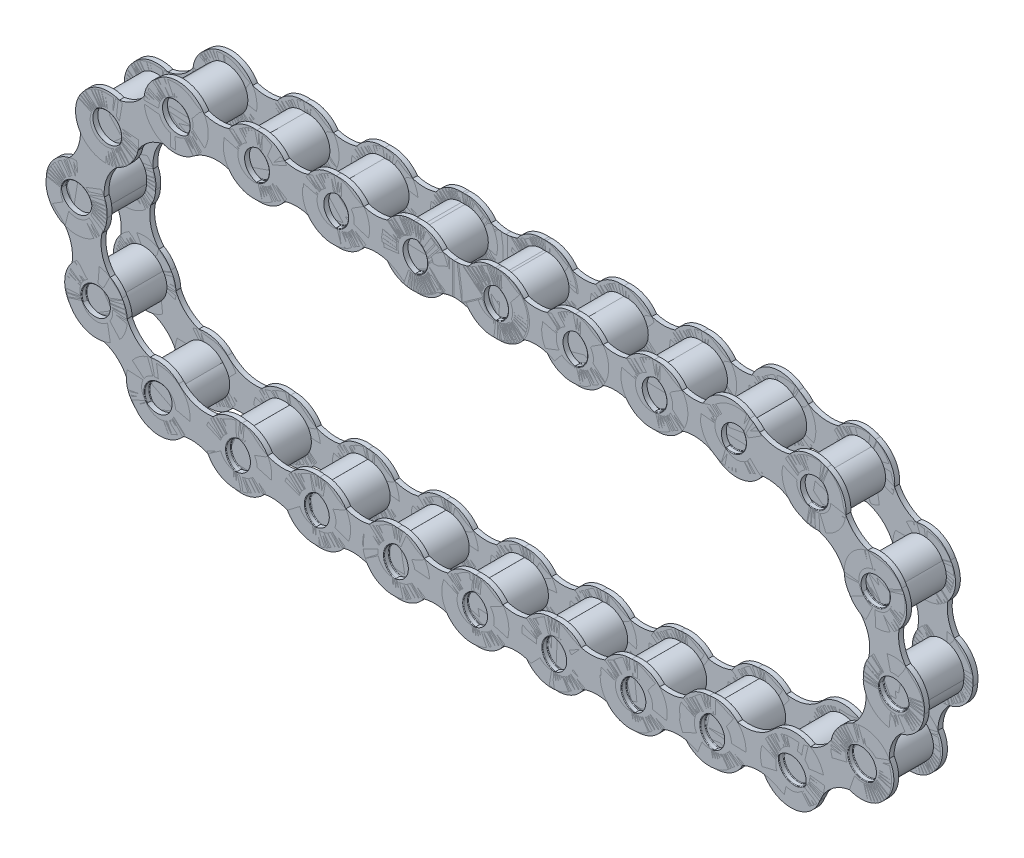
from build123d import *

# Parameters (mm, degrees)
SKETCH1_R            = 6.35
BOSS_EXTRUDE1_DEPTH  = 2.032
FILLET1_R            = 0.254
FILLET2_R            = 0.254
SKETCH2_R            = 8.89
BOSS_EXTRUDE2_DEPTH  = 20.32
SKETCH6_R            = 8.89
BOSS_EXTRUDE3_DEPTH  = 20.32
FILLET1_OF_MIRROR1_R = 0.254
CRVPATTERN1_5_ANGLE  = 6.180112
CRVPATTERN1_6_ANGLE  = 41.6489279
CRVPATTERN1_7_ANGLE  = 77.1177438
CRVPATTERN1_8_ANGLE  = 112.5865597
CRVPATTERN1_9_ANGLE  = 148.0553756
CRVPATTERN1_10_ANGLE = 172.5203769
CRVPATTERN1_11_ANGLE = 174.7371779
CRVPATTERN1_12_ANGLE = 176.9539789
CRVPATTERN1_13_ANGLE = 179.1707799
CRVPATTERN1_14_ANGLE = 178.6124191
CRVPATTERN1_15_ANGLE = 176.3956181
CRVPATTERN1_16_ANGLE = 174.1788171
CRVPATTERN1_17_ANGLE = 171.9620161
CRVPATTERN1_18_ANGLE = 139.1216025
CRVPATTERN1_19_ANGLE = 103.6527866
CRVPATTERN1_20_ANGLE = 68.1839707
CRVPATTERN1_21_ANGLE = 32.7151548


with BuildPart() as part:
    # Sketch1 → Boss-Extrude1 (new body)
    with BuildSketch(Plane.XY):
        with BuildLine():
            ThreePointArc((-9.958015633, 10.00532661), (-30.48, 0), (-9.958015633, -10.00532661))
            ThreePointArc((-9.958015633, -10.00532661), (0, -6.574790509), (9.958015633, -10.00532661))
            ThreePointArc((9.958015633, -10.00532661), (30.48, 0), (9.958015633, 10.00532661))
            ThreePointArc((9.958015633, 10.00532661), (0, 6.574790509), (-9.958015633, 10.00532661))
        make_face()
        with Locations((-17.78, 0)):
            Circle(SKETCH1_R, mode=Mode.SUBTRACT)
        with Locations(Location((17.78, 0, 0), (0, 0, 180))):
            Circle(SKETCH1_R, mode=Mode.SUBTRACT)
    boss_extrude1 = extrude(amount=BOSS_EXTRUDE1_DEPTH)

    # Fillet1
    fillet1_edges = [part.edges().sort_by_distance(p)[0] for p in [
        (-24.13, 0, 0),
        (-24.13, 0, 2.032),
    ]]
    fillet(fillet1_edges, radius=FILLET1_R)

    # Fillet2
    fillet2_edges = [part.edges().sort_by_distance(p)[0] for p in [
        (24.13, 0, 0),
        (24.13, 0, 2.032),
    ]]
    fillet(fillet2_edges, radius=FILLET2_R)

    # Sketch2 → Boss-Extrude2 (add)
    with BuildSketch(Plane.XY):
        with Locations((-17.78, 0)):
            Circle(SKETCH2_R)
    extrude(amount=BOSS_EXTRUDE2_DEPTH)

    # Sketch6 → Boss-Extrude3 (add)
    with BuildSketch(Plane.XY):
        with Locations((17.78, 0)):
            Circle(SKETCH6_R)
    extrude(amount=BOSS_EXTRUDE3_DEPTH)

    # Mirror1: Boss-Extrude1 across plane
    add(boss_extrude1.mirror(Plane.XY.offset(11.176)))

    # Fillet1 of Mirror1
    fillet1_of_mirror1_edges = [part.edges().sort_by_distance(p)[0] for p in [
        (-24.13, 0, 22.352),
        (-24.13, 0, 20.32),
    ]]
    fillet(fillet1_of_mirror1_edges, radius=FILLET1_OF_MIRROR1_R)


with BuildPart() as body_2:
    # CrvPattern1: read off the stored shape, not the designer's step
    # CrvPattern1: copy of part
    add(part.part.moved(Location((0.649884, 0, 0))))


with BuildPart() as body_3:
    # CrvPattern1 2: copy of part
    add(part.part.moved(Location((33.669884, 0, 0))))


with BuildPart() as body_4:
    # CrvPattern1 3: copy of part
    add(part.part.moved(Location((66.689884, 0, 0))))


with BuildPart() as body_5:
    # CrvPattern1 4: copy of part
    add(part.part.moved(Location((99.709884, 0, 0))))


with BuildPart() as body_6:
    # CrvPattern1 5: copy of part
    add(part.part.moved(Location((131.9806599, 13.9820833, 0))).rotate(Axis((0, 0, 0), (0, 0, -1)), CRVPATTERN1_5_ANGLE))


with BuildPart() as body_7:
    # CrvPattern1 6: copy of part
    add(part.part.moved(Location((130.3226475, 97.8824046, 0))).rotate(Axis((0, 0, 0), (0, 0, -1)), CRVPATTERN1_6_ANGLE))


with BuildPart() as body_8:
    # CrvPattern1 7: copy of part
    add(part.part.moved(Location((80.2883285, 165.2513875, 0))).rotate(Axis((0, 0, 0), (0, 0, -1)), CRVPATTERN1_7_ANGLE))


with BuildPart() as body_9:
    # CrvPattern1 8: copy of part
    add(part.part.moved(Location((0.4472946, 191.0859034, 0))).rotate(Axis((0, 0, 0), (0, 0, -1)), CRVPATTERN1_8_ANGLE))


with BuildPart() as body_10:
    # CrvPattern1 9: copy of part
    add(part.part.moved(Location((-79.5684853, 165.7978054, 0))).rotate(Axis((0, 0, 0), (0, 0, -1)), CRVPATTERN1_9_ANGLE))


with BuildPart() as body_11:
    # CrvPattern1 10: copy of part
    add(part.part.moved(Location((-108.7556544, 122.8237659, 0))).rotate(Axis((0, 0, 0), (0, 0, -1)), CRVPATTERN1_10_ANGLE))


with BuildPart() as body_12:
    # CrvPattern1 11: copy of part
    add(part.part.moved(Location((-80.4134432, 119.1646992, 0))).rotate(Axis((0, 0, 0), (0, 0, -1)), CRVPATTERN1_11_ANGLE))


with BuildPart() as body_13:
    # CrvPattern1 12: copy of part
    add(part.part.moved(Location((-51.9509071, 116.6046709, 0))).rotate(Axis((0, 0, 0), (0, 0, -1)), CRVPATTERN1_12_ANGLE))


with BuildPart() as body_14:
    # CrvPattern1 13: copy of part
    add(part.part.moved(Location((-23.4106479, 115.1475128, 0))).rotate(Axis((0, 0, 0), (0, 0, -1)), CRVPATTERN1_13_ANGLE))


with BuildPart() as body_15:
    # CrvPattern1 14: copy of part
    add(part.part.moved(Location((5.1646163, 114.795406, 0))).rotate(Axis((0, 0, 0), (0, 0, 1)), CRVPATTERN1_14_ANGLE))


with BuildPart() as body_16:
    # CrvPattern1 15: copy of part
    add(part.part.moved(Location((33.7321151, 115.5488775, 0))).rotate(Axis((0, 0, 0), (0, 0, 1)), CRVPATTERN1_15_ANGLE))


with BuildPart() as body_17:
    # CrvPattern1 16: copy of part
    add(part.part.moved(Location((62.2490895, 117.4067995, 0))).rotate(Axis((0, 0, 0), (0, 0, 1)), CRVPATTERN1_16_ANGLE))


with BuildPart() as body_18:
    # CrvPattern1 17: copy of part
    add(part.part.moved(Location((90.6728563, 120.3663911, 0))).rotate(Axis((0, 0, 0), (0, 0, 1)), CRVPATTERN1_17_ANGLE))


with BuildPart() as body_19:
    # CrvPattern1 18: copy of part
    add(part.part.moved(Location((41.8875719, 160.1630964, 0))).rotate(Axis((0, 0, 0), (0, 0, 1)), CRVPATTERN1_18_ANGLE))


with BuildPart() as body_20:
    # CrvPattern1 19: copy of part
    add(part.part.moved(Location((-27.8749589, 164.6594247, 0))).rotate(Axis((0, 0, 0), (0, 0, 1)), CRVPATTERN1_19_ANGLE))


with BuildPart() as body_21:
    # CrvPattern1 20: copy of part
    add(part.part.moved(Location((-87.3007968, 127.8409855, 0))).rotate(Axis((0, 0, 0), (0, 0, 1)), CRVPATTERN1_20_ANGLE))


with BuildPart() as body_22:
    # CrvPattern1 21: copy of part
    add(part.part.moved(Location((-114.3348091, 63.3724673, 0))).rotate(Axis((0, 0, 0), (0, 0, 1)), CRVPATTERN1_21_ANGLE))


with BuildPart() as body_23:
    # CrvPattern1 22: copy of part
    add(part.part.moved(Location((-99.06, 0, 0))))


with BuildPart() as body_24:
    # CrvPattern1 23: copy of part
    add(part.part.moved(Location((-66.04, 0, 0))))


with BuildPart() as body_25:
    # CrvPattern1 24: copy of part
    add(part.part.moved(Location((-33.02, 0, 0))))


solid = Compound([part.part, body_2.part, body_3.part, body_4.part, body_5.part, body_6.part, body_7.part, body_8.part, body_9.part, body_10.part, body_11.part, body_12.part, body_13.part, body_14.part, body_15.part, body_16.part, body_17.part, body_18.part, body_19.part, body_20.part, body_21.part, body_22.part, body_23.part, body_24.part, body_25.part])
